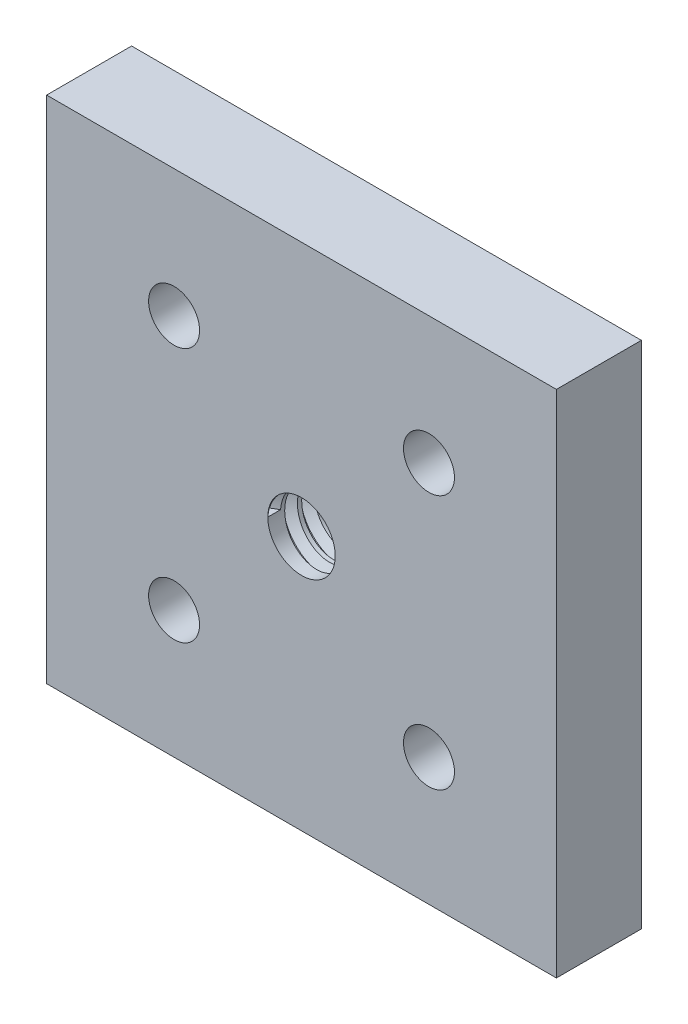
from build123d import *

# Parameters (mm, degrees)
SKETCH1_W           = 60
SKETCH1_H           = 60
BOSS_EXTRUDE1_DEPTH = 10
SKETCH2_R           = 3.96875
CUT_EXTRUDE1_DEPTH  = 44.588989435
THREAD1_PITCH       = 2
SKETCH3_R           = 3
CUT_EXTRUDE2_DEPTH  = 10


with BuildPart() as part:
    # Sketch1 → Boss-Extrude1 (new body)
    with BuildSketch(Plane.XY):
        Rectangle(SKETCH1_W, SKETCH1_H)
    extrude(amount=BOSS_EXTRUDE1_DEPTH)

    # Sketch2 → Cut-Extrude1 (cut, through all)
    with BuildSketch(Plane.XY.offset(10)):
        Circle(SKETCH2_R)
    extrude(amount=-CUT_EXTRUDE1_DEPTH, mode=Mode.SUBTRACT)

    # Thread1: the profile of Thread Profile1 profile screwed along a right-hand helix of 5 turns, 10 arcs to a turn; built about Z, then put on its axis
    thread1_z = Axis((0, 0, 0), (0, 0, 1))
    thread1_corners = [(3.96845, 0, -0.000173205), (5.05128175, 0, 0.624999997), (5.05128175, 0, 0.874999997), (3.96845, 0, 1.5001732)]
    with BuildLine(mode=Mode.PRIVATE) as thread1_profile:
        Line(thread1_corners[0], thread1_corners[1])
        Line(thread1_corners[1], thread1_corners[2])
        Line(thread1_corners[2], thread1_corners[3])
        Line(thread1_corners[3], thread1_corners[0])
    thread1_cap = Face(thread1_profile.wire())
    thread1_turn_angles = [0, 18, 36, 54, 72, 90, 108, 126, 144, 162, 180, 198, 216, 234, 252, 270, 288, 306, 324, 342, 360]
    thread1_turn_weights = [1, 0.9510565162951535, 1, 0.9510565162951535, 1, 0.9510565162951535, 1, 0.9510565162951535, 1, 0.9510565162951535, 1, 0.9510565162951535, 1, 0.9510565162951535, 1, 0.9510565162951535, 1, 0.9510565162951535, 1, 0.9510565162951535, 1]
    thread1_turn_rails = [Edge.make_bspline([Vector(p[0], p[1], 0).rotate(thread1_z, thread1_turn_angles[k]) / thread1_turn_weights[k] + Vector(0, 0, p[2] + THREAD1_PITCH * thread1_turn_angles[k] / 360) for k in range(21)], [0, 0, 0, 1, 1, 2, 2, 3, 3, 4, 4, 5, 5, 6, 6, 7, 7, 8, 8, 9, 9, 10, 10, 10], 2, thread1_turn_weights) for p in thread1_corners]
    thread1_turn_sides = [Face.make_surface_from_curves(thread1_turn_rails[p[0]], thread1_turn_rails[p[1]]) for p in [(0, 1), (1, 2), (2, 3), (3, 0)]]
    thread1 = Plane(origin=(0, 0, 10), x_dir=(-1, 0, 0), z_dir=(0, 0, -1)) * Solid(Shell([*[p.moved(Location((0, 0, THREAD1_PITCH * i))) for i in range(5) for p in thread1_turn_sides], thread1_cap, thread1_cap.rotate(thread1_z, 1800).moved(Location((0, 0, THREAD1_PITCH * 1800 / 360)))]))
    add(thread1, mode=Mode.SUBTRACT)

    # Sketch3 → Cut-Extrude2 (cut)
    with BuildSketch(Plane.XY.offset(10)):
        with Locations((15, 15)):
            Circle(SKETCH3_R)
        with Locations((-15, 15)):
            Circle(SKETCH3_R)
        with Locations((-15, -15)):
            Circle(SKETCH3_R)
        with Locations((15, -15)):
            Circle(SKETCH3_R)
    extrude(amount=-CUT_EXTRUDE2_DEPTH, mode=Mode.SUBTRACT)


solid = part.part
